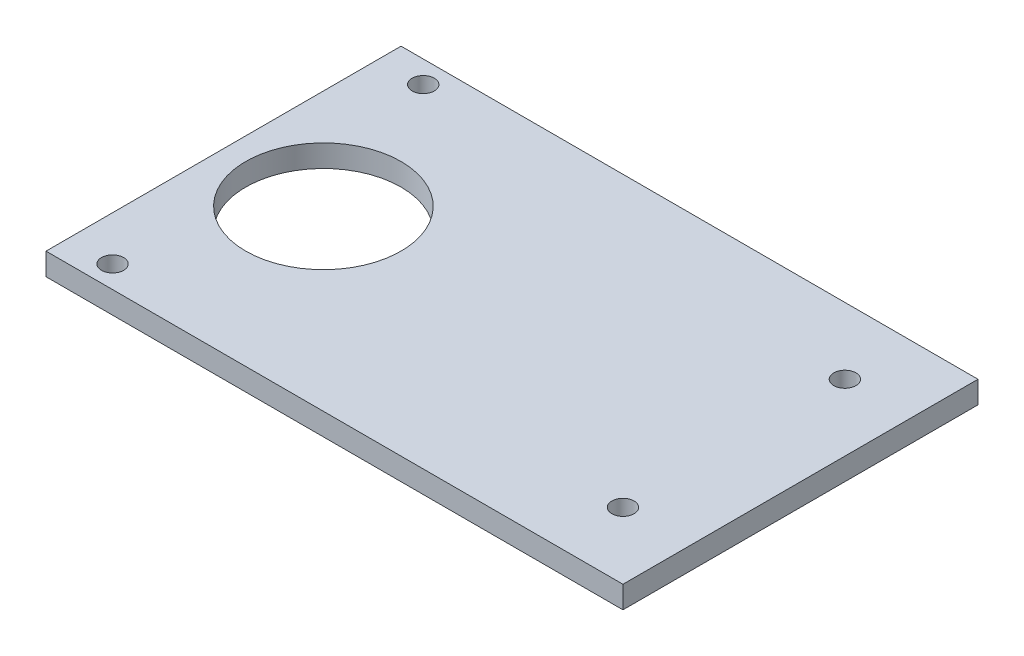
from build123d import *

# Parameters (mm, degrees)
SKETCH1_W           = 130
SKETCH1_H           = 80
SKETCH1_R           = 17.5
SKETCH1_R_2         = 2.5
BOSS_EXTRUDE1_DEPTH = 5


with BuildPart() as part:
    # Sketch1 → Boss-Extrude1 (new body)
    with BuildSketch(Plane(origin=(0, 0, 0), x_dir=(1, 0, 0), z_dir=(0, 1, 0))):
        with Locations((-4.718309859, -5.352112676)):
            Rectangle(SKETCH1_W, SKETCH1_H)
        with Locations((-47.218309859, -5.352112676)):
            Circle(SKETCH1_R, mode=Mode.SUBTRACT)
        with Locations((45.281690141, 19.647887324)):
            Circle(SKETCH1_R_2, mode=Mode.SUBTRACT)
        with Locations((-59.718309859, 29.647887324)):
            Circle(SKETCH1_R_2, mode=Mode.SUBTRACT)
        with Locations((45.281690141, -30.352112676)):
            Circle(SKETCH1_R_2, mode=Mode.SUBTRACT)
        with Locations((-59.718309859, -40.352112676)):
            Circle(SKETCH1_R_2, mode=Mode.SUBTRACT)
    extrude(amount=BOSS_EXTRUDE1_DEPTH)


solid = part.part
